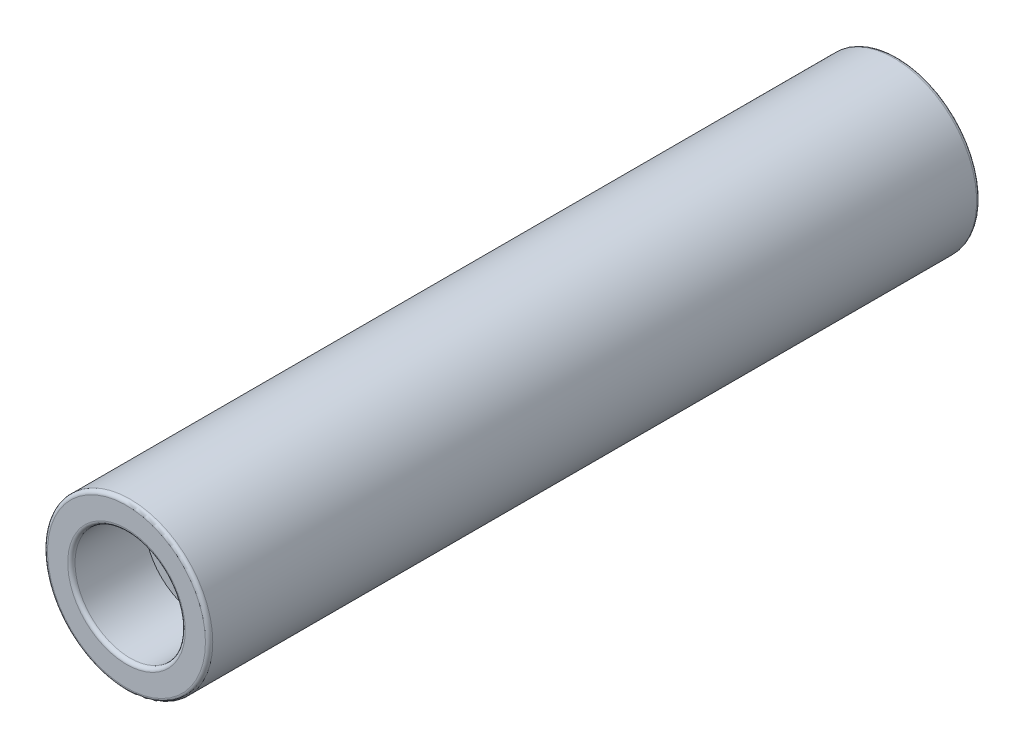
from build123d import *

# Parameters (mm, degrees)
SKETCH1_R           = 4.5
SKETCH1_R_2         = 3
EXTRUDE_THIN1_DEPTH = 12
SKETCH11_R          = 4.5
SKETCH11_R_2        = 1.5
EXTRUDE_THIN3_DEPTH = 5
SKETCH12_R          = 4.5
SKETCH12_R_2        = 3
EXTRUDE_THIN4_DEPTH = 4
THREAD1_PITCH       = 0.5
FILLET2_R           = 0.2


# Read off the part's stored shape, not the designer's step: Revolve1
with BuildPart() as part:
    # Sketch1 → Extrude-Thin1 (new body)
    with BuildSketch(Plane.XY):
        Circle(SKETCH1_R)
        Circle(SKETCH1_R_2, mode=Mode.SUBTRACT)
    extrude_thin1 = extrude(amount=EXTRUDE_THIN1_DEPTH)

    # Sketch11 → Extrude-Thin3 (add)
    with BuildSketch(Plane.XY.offset(12)):
        Circle(SKETCH11_R)
        Circle(SKETCH11_R_2, mode=Mode.SUBTRACT)
    extrude_thin3 = extrude(amount=EXTRUDE_THIN3_DEPTH)

    # Sketch12 → Extrude-Thin4 (add)
    with BuildSketch(Plane.XY.offset(17)):
        Circle(SKETCH12_R)
        Circle(SKETCH12_R_2, mode=Mode.SUBTRACT)
    extrude_thin4 = extrude(amount=EXTRUDE_THIN4_DEPTH)

    # Thread1: the profile of Thread Profile1 profile screwed along a right-hand helix of 10 turns, 6 arcs to a turn; built about Z, then put on its axis
    thread1_z = Axis((0, 0, 0), (0, 0, 1))
    thread1_corners = [(1.5003, 0, -0.000173205), (1.5003, 0, 0.437673204), (1.229367063, 0, 0.281249999), (1.229367063, 0, 0.156249999)]
    with BuildLine(mode=Mode.PRIVATE) as thread1_profile:
        Line(thread1_corners[0], thread1_corners[1])
        Line(thread1_corners[1], thread1_corners[2])
        Line(thread1_corners[2], thread1_corners[3])
        Line(thread1_corners[3], thread1_corners[0])
    thread1_cap = Face(thread1_profile.wire())
    thread1_turn_angles = [0, 30, 60, 90, 120, 150, 180, 210, 240, 270, 300, 330, 360]
    thread1_turn_weights = [1, 0.8660254037844387, 1, 0.8660254037844387, 1, 0.8660254037844387, 1, 0.8660254037844387, 1, 0.8660254037844387, 1, 0.8660254037844387, 1]
    thread1_turn_rails = [Edge.make_bspline([Vector(p[0], p[1], 0).rotate(thread1_z, thread1_turn_angles[k]) / thread1_turn_weights[k] + Vector(0, 0, p[2] + THREAD1_PITCH * thread1_turn_angles[k] / 360) for k in range(13)], [0, 0, 0, 1, 1, 2, 2, 3, 3, 4, 4, 5, 5, 6, 6, 6], 2, thread1_turn_weights) for p in thread1_corners]
    thread1_turn_sides = [Face.make_surface_from_curves(thread1_turn_rails[p[0]], thread1_turn_rails[p[1]]) for p in [(0, 1), (1, 2), (2, 3), (3, 0)]]
    thread1 = Plane(origin=(0, 0, 12), x_dir=(1, 0, 0), z_dir=(0, 0, 1)) * Solid(Shell([*[p.moved(Location((0, 0, THREAD1_PITCH * i))) for i in range(10) for p in thread1_turn_sides], thread1_cap, thread1_cap.rotate(thread1_z, 3600).moved(Location((0, 0, THREAD1_PITCH * 3600 / 360)))]))
    add(thread1)

    # Mirror2: Extrude-Thin1, Extrude-Thin3, Extrude-Thin4, Thread1 across plane
    add(extrude_thin1.mirror(Plane.XY))
    add(extrude_thin3.mirror(Plane.XY))
    add(extrude_thin4.mirror(Plane.XY))
    add(thread1.mirror(Plane.XY))

    # Fillet2
    fillet2_edges = [part.edges().sort_by_distance(p)[0] for p in [
        (-4.5, 0, 21),
        (-3, 0, 21),
        (-4.5, 0, -21),
        (-3, 0, -21),
    ]]
    fillet(fillet2_edges, radius=FILLET2_R)

    # Revolve1 outline → Revolve1 (revolve)
    with BuildSketch(Plane.XZ):
        Polygon((3, 12), (1.5, 12), (3, 10.5), align=None)
    revolve1 = revolve(axis=Axis((0, 0, 0), (0, 0, 1)))

    # Mirror3: Revolve1 across plane
    add(revolve1.mirror(Plane.XY))


solid = part.part
